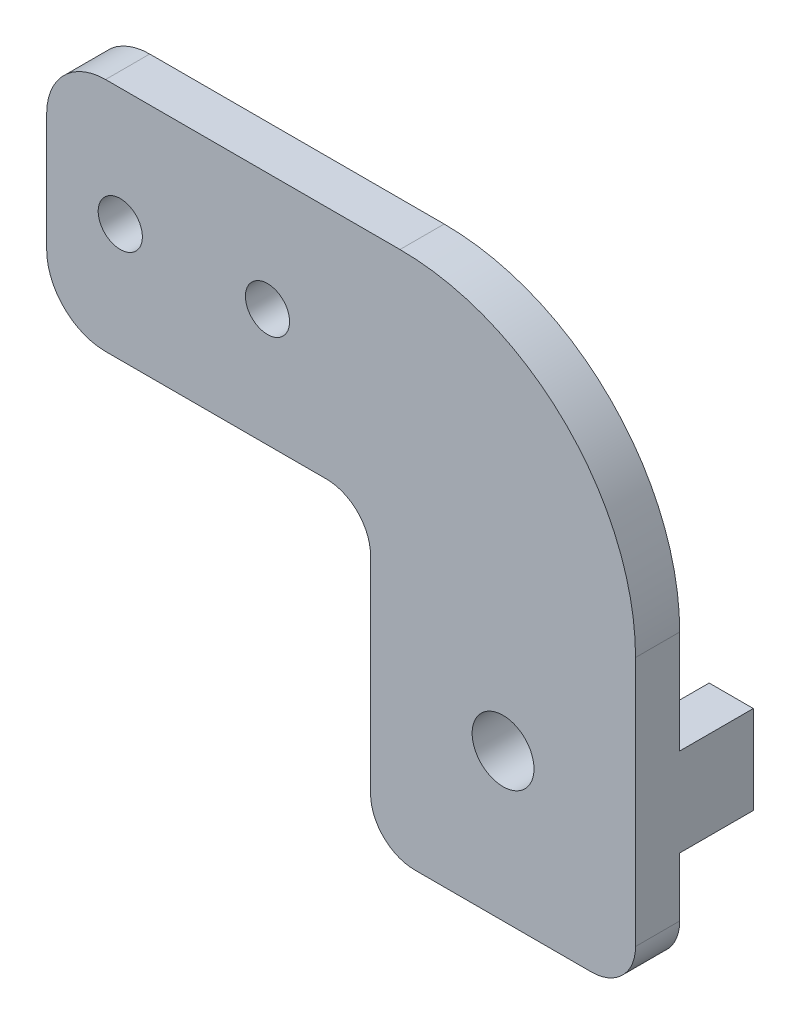
from build123d import *

# Parameters (mm, degrees)
SKETCH_1_R      = 2.1
SKETCH_1_R_2    = 1.5
EXTRUDE_1_DEPTH = 3
SKETCH_1_3_W    = 3
SKETCH_1_3_H    = 6
EXTRUDE_2_DEPTH = 5


with BuildPart() as part:
    # 草图1 → 凸台-拉伸1 (new body)
    with BuildSketch(Plane.XY):
        with BuildLine():
            Line((28, 36), (8, 36))
            ThreePointArc((8, 36), (5.171572875, 34.828427125), (4, 32))
            Line((4, 32), (4, 24))
            ThreePointArc((4, 24), (5.171572875, 21.171572875), (8, 20))
            Line((8, 20), (23, 20))
            ThreePointArc((23, 20), (25.121320344, 19.121320344), (26, 17))
            Line((26, 17), (26, 3))
            ThreePointArc((26, 3), (26.878679656, 0.878679656), (29, 0))
            Line((29, 0), (41, 0))
            ThreePointArc((41, 0), (43.121320344, 0.878679656), (44, 3))
            Line((44, 3), (44, 20))
            ThreePointArc((44, 20), (39.313708499, 31.313708499), (28, 36))
        make_face()
        with Locations((35, 10)):
            Circle(SKETCH_1_R, mode=Mode.SUBTRACT)
        with Locations((9, 28)):
            Circle(SKETCH_1_R_2, mode=Mode.SUBTRACT)
        with Locations((19, 28)):
            Circle(SKETCH_1_R_2, mode=Mode.SUBTRACT)
    extrude(amount=EXTRUDE_1_DEPTH)

    # 草图1<3> → 凸台-拉伸2 (add)
    with BuildSketch(Plane.XY):
        with Locations((42.5, 10)):
            Rectangle(SKETCH_1_3_W, SKETCH_1_3_H)
        with Locations((27.5, 10)):
            Rectangle(SKETCH_1_3_W, SKETCH_1_3_H)
    extrude(amount=-EXTRUDE_2_DEPTH)


solid = part.part
